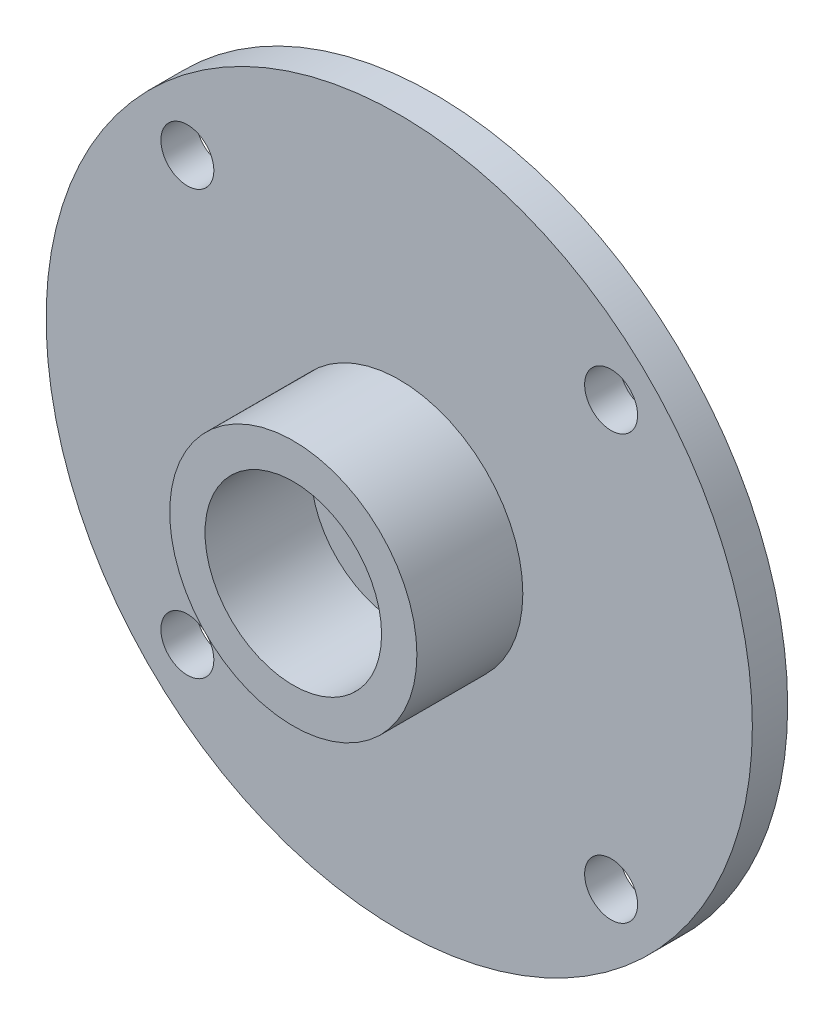
from build123d import *

# Parameters (mm, degrees)
SKETCH_1_R      = 20
SKETCH_1_R_2    = 1.5
SKETCH_1_R_3    = 3
EXTRUDE_1_DEPTH = 2
SKETCH_3_R      = 11
SKETCH_3_R_2    = 7.5
EXTRUDE_2_DEPTH = 5
SKETCH_2_R      = 7
SKETCH_2_R_2    = 5
EXTRUDE_3_DEPTH = 6


with BuildPart() as part:
    # 草图1 → 凸台-拉伸1 (new body)
    with BuildSketch(Plane.XY):
        Circle(SKETCH_1_R)
        with Locations((-12, 12)):
            Circle(SKETCH_1_R_2, mode=Mode.SUBTRACT)
        with Locations((12, 12)):
            Circle(SKETCH_1_R_2, mode=Mode.SUBTRACT)
        with Locations((12, -12)):
            Circle(SKETCH_1_R_2, mode=Mode.SUBTRACT)
        with Locations((-12, -12)):
            Circle(SKETCH_1_R_2, mode=Mode.SUBTRACT)
        Circle(SKETCH_1_R_3, mode=Mode.SUBTRACT)
    extrude(amount=EXTRUDE_1_DEPTH)

    # 草图3 → 凸台-拉伸2 (add)
    with BuildSketch(Plane(origin=(0, 0, 0), x_dir=(-1, 0, 0), z_dir=(0, 0, -1))):
        Circle(SKETCH_3_R)
        Circle(SKETCH_3_R_2, mode=Mode.SUBTRACT)
    extrude(amount=EXTRUDE_2_DEPTH)

    # 草图2 → 凸台-拉伸3 (add)
    with BuildSketch(Plane.XY.offset(2)):
        Circle(SKETCH_2_R)
        Circle(SKETCH_2_R_2, mode=Mode.SUBTRACT)
    extrude(amount=EXTRUDE_3_DEPTH)


solid = part.part
